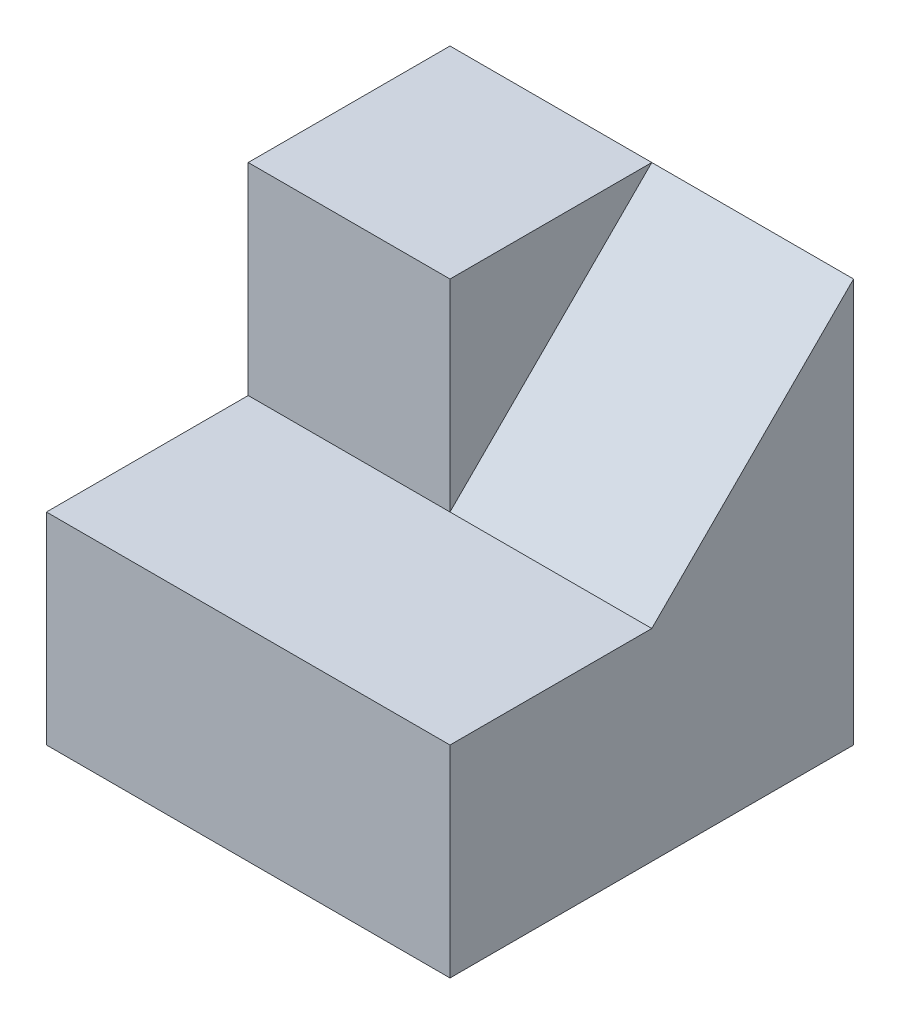
from build123d import *

# Parameters (mm, degrees)
CROQUIS1_W              = 100
CROQUIS1_H              = 100
SALIENTE_EXTRUIR1_DEPTH = 50
CROQUIS2_W              = 50
CROQUIS2_H              = 50
SALIENTE_EXTRUIR3_DEPTH = 50
SALIENTE_EXTRUIR4_DEPTH = 50


with BuildPart() as part:
    # Croquis1 → Saliente-Extruir1 (new body)
    with BuildSketch(Plane(origin=(0, 0, 0), x_dir=(1, 0, 0), z_dir=(0, 1, 0))):
        with Locations((9.571472252, 22.737819026)):
            Rectangle(CROQUIS1_W, CROQUIS1_H)
    extrude(amount=SALIENTE_EXTRUIR1_DEPTH)

    # Croquis2 → Saliente-Extruir3 (add)
    with BuildSketch(Plane(origin=(0, 50, 0), x_dir=(1, 0, 0), z_dir=(0, 1, 0))):
        with Locations((-15.428527748, 47.737819026)):
            Rectangle(CROQUIS2_W, CROQUIS2_H)
    extrude(amount=SALIENTE_EXTRUIR3_DEPTH)

    # Croquis3 → Saliente-Extruir4 (add)
    with BuildSketch(Plane(origin=(59.571472252, 0, 0), x_dir=(0, 0, -1), z_dir=(1, 0, 0))):
        Polygon((22.737819026, 50), (72.737819026, 100), (72.737819026, 50), align=None)
    extrude(amount=-SALIENTE_EXTRUIR4_DEPTH)


solid = part.part
